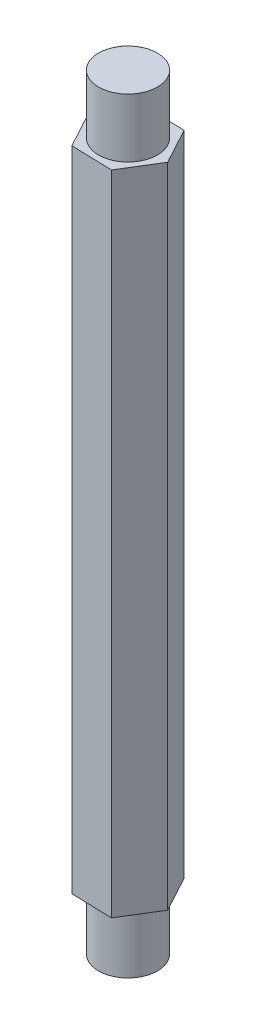
from build123d import *

# Parameters (mm, degrees)
SKETCH1_R           = 1.5
BOSS_EXTRUDE1_DEPTH = 3
BOSS_EXTRUDE2_DEPTH = 33
SKETCH3_R           = 1.5
BOSS_EXTRUDE3_DEPTH = 3


with BuildPart() as part:
    # Sketch1 → Boss-Extrude1 (new body)
    with BuildSketch(Plane(origin=(0, 0, 0), x_dir=(1, 0, 0), z_dir=(0, 1, 0))):
        Circle(SKETCH1_R)
    extrude(amount=BOSS_EXTRUDE1_DEPTH)

    # Sketch2 → Boss-Extrude2 (add)
    with BuildSketch(Plane(origin=(0, 3, 0), x_dir=(1, 0, 0), z_dir=(0, 1, 0))):
        Polygon((-0.98915483, 1.827996915), (-2.077669182, 0.057365247), (-1.088514352, -1.770631668), (0.98915483, -1.827996915), (2.077669182, -0.057365247), (1.088514352, 1.770631668), align=None)
    extrude(amount=BOSS_EXTRUDE2_DEPTH)

    # Sketch3 → Boss-Extrude3 (add)
    with BuildSketch(Plane(origin=(0, 36, 0), x_dir=(1, 0, 0), z_dir=(0, 1, 0))):
        Circle(SKETCH3_R)
    extrude(amount=BOSS_EXTRUDE3_DEPTH)


solid = part.part
